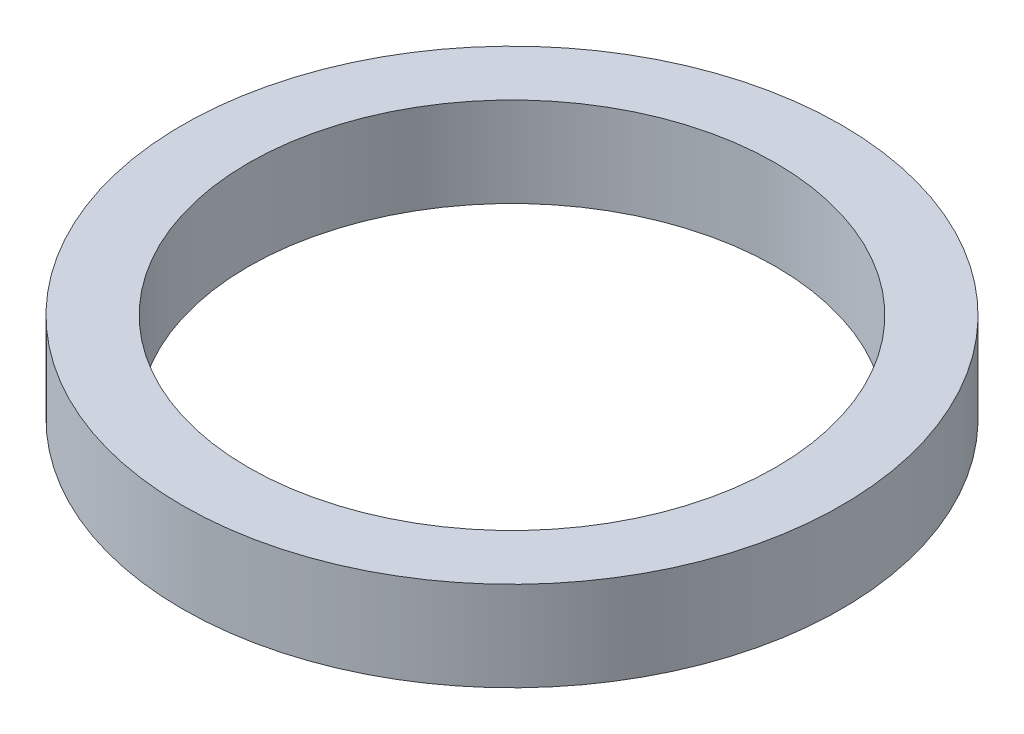
from build123d import *

# Parameters (mm, degrees)
SKETCH1_R           = 62.5
BOSS_EXTRUDE1_DEPTH = 17
SKETCH2_R           = 50
CUT_EXTRUDE1_DEPTH  = 91.008332948


with BuildPart() as part:
    # Sketch1 → Boss-Extrude1 (new body)
    with BuildSketch(Plane(origin=(0, 0, 0), x_dir=(1, 0, 0), z_dir=(0, 1, 0))):
        Circle(SKETCH1_R)
    extrude(amount=BOSS_EXTRUDE1_DEPTH)

    # Sketch2 → Cut-Extrude1 (cut, through all)
    with BuildSketch(Plane(origin=(0, 0, 0), x_dir=(1, 0, 0), z_dir=(0, 1, 0))):
        Circle(SKETCH2_R)
    extrude(amount=CUT_EXTRUDE1_DEPTH, mode=Mode.SUBTRACT)


solid = part.part
